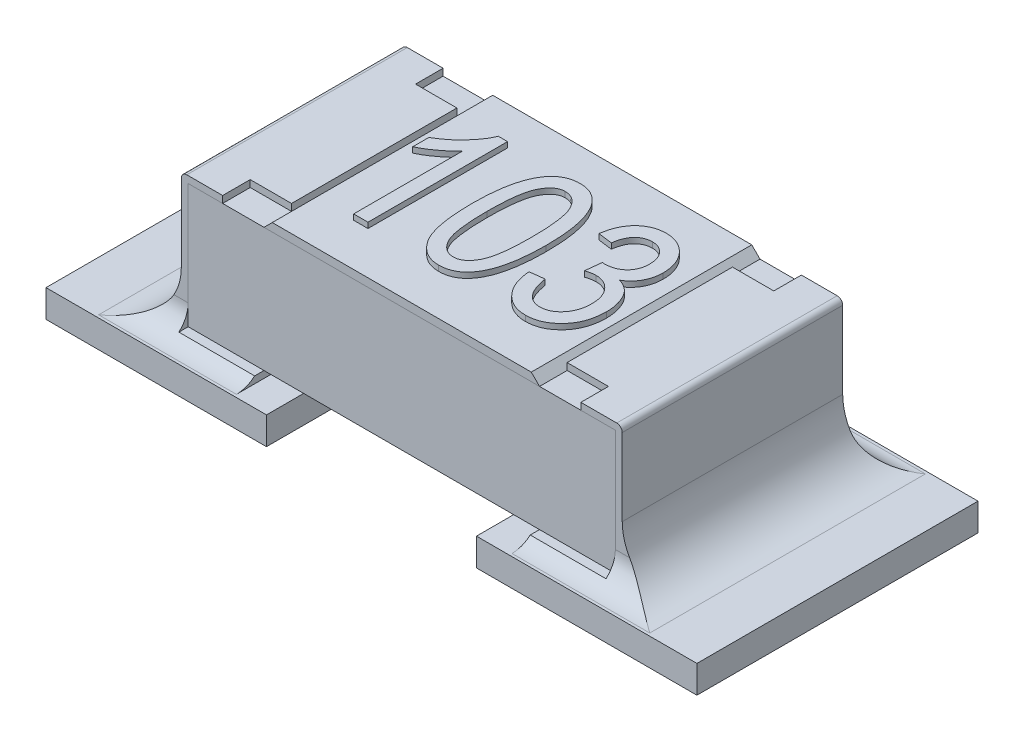
from build123d import *

# Parameters (mm, degrees)
SKETCH1_W             = 0.8
SKETCH1_H             = 0.45
BOSS_EXTRUDE1_DEPTH   = 0.775
BOSS_EXTRUDE2_DEPTH   = 0.4
BOSS_EXTRUDE2_2_DEPTH = 0.4
SKETCH3_W             = 0.15
SKETCH3_H             = 0.1
CUT_EXTRUDE1_DEPTH    = 0.025
BOSS_EXTRUDE3_DEPTH   = 0.4
SKETCH7_W             = 0.8
SKETCH7_H             = 1.02
BOSS_EXTRUDE5_DEPTH   = 0.1
FILLET3_R             = 0.2
FILLET4_R             = 0.2
FILLET5_R             = 0.1
FILLET6_R             = 0.1
BOSS_EXTRU_1_DEPTH    = 0.02


with BuildPart() as part:
    # Sketch1 → Boss-Extrude1 (new, symmetric)
    with BuildSketch(Plane(origin=(0, 0, 0), x_dir=(0, 0, -1), z_dir=(1, 0, 0))):
        with Locations((0, 0.35)):
            Rectangle(SKETCH1_W, SKETCH1_H)
    extrude(amount=BOSS_EXTRUDE1_DEPTH, both=True)


with BuildPart() as body_2:
    # Sketch2 → Boss-Extrude2 (new, symmetric)
    with BuildSketch(Plane.XY):
        with BuildLine():
            Line((-0.5, 0.6), (-0.78, 0.6))
            ThreePointArc((-0.78, 0.6), (-0.794142136, 0.594142136), (-0.8, 0.58))
            Line((-0.8, 0.58), (-0.8, 0.1))
            Line((-0.8, 0.1), (-0.5, 0.1))
            Line((-0.5, 0.1), (-0.5, 0.125))
            Line((-0.5, 0.125), (-0.775, 0.125))
            Line((-0.775, 0.125), (-0.775, 0.575))
            Line((-0.775, 0.575), (-0.5, 0.575))
            Line((-0.5, 0.575), (-0.5, 0.6))
        make_face()
    extrude(amount=BOSS_EXTRUDE2_DEPTH, both=True)


with BuildPart() as body_3:
    # Sketch2 → Boss-Extrude2 2 (new, symmetric)
    with BuildSketch(Plane.XY):
        with BuildLine():
            Line((0.5, 0.575), (0.5, 0.6))
            Line((0.5, 0.6), (0.78, 0.6))
            ThreePointArc((0.78, 0.6), (0.794142136, 0.594142136), (0.8, 0.58))
            Line((0.8, 0.58), (0.8, 0.1))
            Line((0.8, 0.1), (0.5, 0.1))
            Line((0.5, 0.1), (0.5, 0.125))
            Line((0.5, 0.125), (0.775, 0.125))
            Line((0.775, 0.125), (0.775, 0.575))
            Line((0.775, 0.575), (0.5, 0.575))
        make_face()
    extrude(amount=BOSS_EXTRUDE2_2_DEPTH, both=True)


with BuildPart() as cut_extrude1_tool:
    # Sketch3 → Cut-Extrude1 (new body)
    with BuildSketch(Plane(origin=(0, 0.6, 0), x_dir=(1, 0, 0), z_dir=(0, 1, 0))):
        with Locations((-0.575, 0.35)):
            Rectangle(SKETCH3_W, SKETCH3_H)
        with Locations((-0.575, -0.35)):
            Rectangle(SKETCH3_W, SKETCH3_H)
        with Locations((0.575, -0.35)):
            Rectangle(SKETCH3_W, SKETCH3_H)
        with Locations((0.575, 0.35)):
            Rectangle(SKETCH3_W, SKETCH3_H)
    extrude(amount=-CUT_EXTRUDE1_DEPTH)


with BuildPart() as body_2_1:
    add(body_2.part)

    # Cut-Extrude1: cut by cut_extrude1_tool
    add(cut_extrude1_tool.part, mode=Mode.SUBTRACT)



with BuildPart() as body_3_1:
    add(body_3.part)

    # Cut-Extrude1: cut by cut_extrude1_tool
    add(cut_extrude1_tool.part, mode=Mode.SUBTRACT)


with BuildPart() as body_4:
    # Sketch4 → Boss-Extrude3 (new, symmetric)
    with BuildSketch(Plane.XY):
        Polygon((-0.5, 0.575), (0.5, 0.575), (0.47, 0.605), (-0.47, 0.605), align=None)
    extrude(amount=BOSS_EXTRUDE3_DEPTH, both=True)

    # Esquisse2 → Boss.-Extru.1 (add)
    # profile 1 of 3: a face of its own
    with BuildSketch(Plane(origin=(0, 0.605, 0), x_dir=(1, 0, 0), z_dir=(0, 1, 0))):
        with BuildLine():
            Line((-0.277419159, -0.245221888), (-0.329367211, -0.245221888))
            Line((-0.329367211, -0.245221888), (-0.329367211, 0.150882009))
            add(Edge.make_bspline(
                [(-0.329367211, 0.150882009), (-0.33255753, 0.147209677), (-0.339169464, 0.139598774), (-0.350647442, 0.128775009), (-0.363438381, 0.1176135), (-0.377599648, 0.106782892), (-0.392028853, 0.096408923), (-0.406280373, 0.087284837), (-0.41982007, 0.079346193), (-0.428903295, 0.075031174), (-0.433263315, 0.072959931)],
                knots=[0, 0, 0, 0, 0.892555828, 1.849821039, 2.893015883, 4.008277588, 5.121255548, 6.154629642, 7.114207698, 8, 8, 8, 8], degree=3))
            Line((-0.433263315, 0.072959931), (-0.433263315, 0.131401489))
            add(Edge.make_bspline(
                [(-0.433263315, 0.131401489), (-0.426256411, 0.13561851), (-0.412302603, 0.144016443), (-0.392751491, 0.158564375), (-0.374281809, 0.174266475), (-0.35744561, 0.191287267), (-0.342370643, 0.208833156), (-0.329431452, 0.226343975), (-0.318822135, 0.243633673), (-0.313617925, 0.255526991), (-0.311104224, 0.261271619)],
                knots=[0, 0, 0, 0, 1.082272232, 2.155277244, 3.222407096, 4.289527553, 5.32168536, 6.282742408, 7.170542132, 8, 8, 8, 8], degree=3))
            Line((-0.311104224, 0.261271619), (-0.277419159, 0.261271619))
            Line((-0.277419159, 0.261271619), (-0.277419159, -0.245221888))
        make_face()
    # profile 2 of 3: a face of its own
    with BuildSketch(Plane(origin=(0, 0.605, 0), x_dir=(1, 0, 0), z_dir=(0, 1, 0))):
        with BuildLine():
            add(Edge.make_bspline(
                [(-0.147549029, 0.00457519), (-0.147466537, 0.01479126), (-0.147306358, 0.034628409), (-0.145650941, 0.063399949), (-0.143039858, 0.090278959), (-0.139489137, 0.115229398), (-0.134683655, 0.138255011), (-0.12902472, 0.15939274), (-0.122074419, 0.178575365), (-0.114251427, 0.195885139), (-0.105280253, 0.21122541), (-0.095389914, 0.224648892), (-0.084287025, 0.235937722), (-0.072277736, 0.245324824), (-0.059123137, 0.252476152), (-0.04501046, 0.257615666), (-0.029887534, 0.260717058), (-0.019452187, 0.261084261), (-0.014127763, 0.261271619)],
                knots=[0, 0, 0, 0, 1.522295809, 2.955932353, 4.292935845, 5.545987552, 6.709403679, 7.796379217, 8.803980711, 9.746667296, 10.623167879, 11.447716403, 12.224665142, 12.975696349, 13.710987297, 14.4460191, 15.207112772, 16, 16, 16, 16], degree=3))
            add(Edge.make_bspline(
                [(-0.014127763, 0.261271619), (-0.00938285, 0.261119405), (-6.4928e-05, 0.260820492), (0.013532278, 0.258355488), (0.026321328, 0.254161939), (0.038311883, 0.248334155), (0.04946752, 0.240809961), (0.059897997, 0.231712272), (0.069489012, 0.22085766), (0.075042737, 0.212703293), (0.0778974, 0.208511879)],
                knots=[0, 0, 0, 0, 1.02435884, 2.0116063, 2.972586715, 3.92329494, 4.881606269, 5.870473939, 6.905405214, 8, 8, 8, 8], degree=3))
            add(Edge.make_bspline(
                [(0.0778974, 0.208511879), (0.081201753, 0.202860902), (0.088073505, 0.191109101), (0.09627871, 0.171419216), (0.103194942, 0.149427268), (0.109026426, 0.125063264), (0.113186158, 0.098276968), (0.116478331, 0.069172575), (0.118383679, 0.037676929), (0.118581978, 0.015873733), (0.118684737, 0.00457519)],
                knots=[0, 0, 0, 0, 0.745747152, 1.550859881, 2.42529298, 3.372802996, 4.404287875, 5.514077945, 6.711780846, 8, 8, 8, 8], degree=3))
            add(Edge.make_bspline(
                [(0.118684737, 0.00457519), (0.118603246, -0.005573368), (0.118445039, -0.025275587), (0.116773055, -0.053910105), (0.114196761, -0.080658499), (0.110597814, -0.10553284), (0.105836898, -0.128501924), (0.100102772, -0.149633905), (0.093369381, -0.168919426), (0.085438101, -0.186231046), (0.076598991, -0.201660817), (0.066540873, -0.214948272), (0.055705564, -0.226438872), (0.043540388, -0.23562265), (0.030475546, -0.242976397), (0.016267757, -0.248029288), (0.001094421, -0.251174149), (-0.009377101, -0.25153216), (-0.014736529, -0.251715394)],
                knots=[0, 0, 0, 0, 1.513874866, 2.939007974, 4.277477108, 5.521918538, 6.686610019, 7.774777114, 8.786532326, 9.730252297, 10.61206932, 11.433487149, 12.211385775, 12.960169701, 13.698700869, 14.439280195, 15.201208188, 16, 16, 16, 16], degree=3))
            add(Edge.make_bspline(
                [(-0.014736529, -0.251715394), (-0.019516724, -0.251535975), (-0.028915126, -0.251183218), (-0.042705055, -0.248501144), (-0.05575647, -0.243876751), (-0.068138313, -0.237523555), (-0.079867046, -0.229401051), (-0.090799365, -0.219338145), (-0.101199397, -0.207599728), (-0.110942062, -0.19396939), (-0.119746041, -0.178096762), (-0.127188231, -0.159604049), (-0.133528749, -0.138579583), (-0.138560256, -0.114938484), (-0.142795274, -0.08877738), (-0.145456819, -0.059965056), (-0.147220924, -0.028557109), (-0.147436804, -0.006757381), (-0.147549029, 0.00457519)],
                knots=[0, 0, 0, 0, 0.713782411, 1.403376538, 2.088831486, 2.775699897, 3.476400496, 4.213162367, 4.989742879, 5.815463779, 6.710980744, 7.6941898, 8.787315853, 9.987366569, 11.302150399, 12.743876293, 14.307306722, 16, 16, 16, 16], degree=3))
        make_face()
        with BuildLine():
            add(Edge.make_bspline(
                [(-0.095600977, 0.004778112), (-0.095510395, -0.004962844), (-0.095337358, -0.023570963), (-0.094386416, -0.050273881), (-0.092589043, -0.074440086), (-0.090092676, -0.096145725), (-0.086927693, -0.115301137), (-0.083021376, -0.132011786), (-0.078366616, -0.146209724), (-0.072890289, -0.158097103), (-0.066817423, -0.167965156), (-0.060330818, -0.176373903), (-0.053623871, -0.183666527), (-0.046292266, -0.189491854), (-0.038680682, -0.194202042), (-0.030494994, -0.19727545), (-0.022023943, -0.199493814), (-0.016171753, -0.199675523), (-0.013214613, -0.199767342)],
                knots=[0, 0, 0, 0, 1.930873368, 3.688541263, 5.295281011, 6.732986767, 8.018032389, 9.141589856, 10.131594649, 10.974379403, 11.729767228, 12.422984227, 13.077418253, 13.687793181, 14.274134012, 14.843047171, 15.415386244, 16, 16, 16, 16], degree=3))
            add(Edge.make_bspline(
                [(-0.013214613, -0.199767342), (-0.010427064, -0.19967107), (-0.004876608, -0.199479377), (0.003214206, -0.197283662), (0.011014124, -0.194062792), (0.018392056, -0.189401372), (0.025337409, -0.183405877), (0.031944313, -0.176126804), (0.038222607, -0.167556151), (0.044243115, -0.157540122), (0.049661257, -0.145592351), (0.054269802, -0.131326946), (0.058147641, -0.114621658), (0.061355308, -0.095476215), (0.063679163, -0.073856395), (0.065539644, -0.049836144), (0.066465897, -0.023333722), (0.066643834, -0.004861208), (0.066736685, 0.004778112)],
                knots=[0, 0, 0, 0, 0.556098029, 1.107279675, 1.665020537, 2.239289732, 2.843790749, 3.494855459, 4.20099618, 4.965402842, 5.827994078, 6.818278647, 7.958442113, 9.254955883, 10.697998423, 12.305588537, 14.072183745, 16, 16, 16, 16], degree=3))
            add(Edge.make_bspline(
                [(0.066736685, 0.004778112), (0.066644247, 0.014518953), (0.066467022, 0.033194439), (0.065536544, 0.059932684), (0.063706558, 0.084163121), (0.061254358, 0.105841815), (0.058028708, 0.125018143), (0.054199757, 0.141717126), (0.049468888, 0.155886496), (0.044070333, 0.167750164), (0.037873861, 0.177530431), (0.031547138, 0.186066808), (0.024613966, 0.193179002), (0.017326453, 0.199101273), (0.009578464, 0.203716122), (0.001336, 0.207013805), (-0.007336855, 0.208998194), (-0.013272092, 0.209214654), (-0.016258444, 0.209323567)],
                knots=[0, 0, 0, 0, 1.926173374, 3.692928135, 5.28908838, 6.72993665, 8.005261178, 9.132588719, 10.113846285, 10.954579593, 11.702439438, 12.399284011, 13.051919516, 13.660808713, 14.251466784, 14.827675714, 15.41013748, 16, 16, 16, 16], degree=3))
            add(Edge.make_bspline(
                [(-0.016258444, 0.209323567), (-0.019046448, 0.209229838), (-0.024564948, 0.209044314), (-0.032588492, 0.206839344), (-0.040285896, 0.203615308), (-0.047609781, 0.198933153), (-0.054467733, 0.192853165), (-0.061128216, 0.185619176), (-0.067268818, 0.176971227), (-0.073311403, 0.16704689), (-0.078634531, 0.155067165), (-0.083250225, 0.140826575), (-0.086962575, 0.124091318), (-0.090243034, 0.105003485), (-0.092537193, 0.083411294), (-0.094405868, 0.059392779), (-0.095329633, 0.03288983), (-0.095507935, 0.014417392), (-0.095600977, 0.004778112)],
                knots=[0, 0, 0, 0, 0.557102101, 1.102712893, 1.655222221, 2.224793741, 2.834805151, 3.487045402, 4.190458401, 4.956245252, 5.811421647, 6.809929224, 7.950602775, 9.242777249, 10.688425301, 12.298918027, 14.068702942, 16, 16, 16, 16], degree=3))
        make_face(mode=Mode.SUBTRACT)
    # profile 3 of 3: a face of its own
    with BuildSketch(Plane(origin=(0, 0.605, 0), x_dir=(1, 0, 0), z_dir=(0, 1, 0))):
        with BuildLine():
            Line((0.170632789, -0.108858251), (0.222580841, -0.102364745))
            add(Edge.make_bspline(
                [(0.222580841, -0.102364745), (0.223250829, -0.106295854), (0.22455639, -0.113956147), (0.227125155, -0.124979634), (0.22992872, -0.135294754), (0.233178113, -0.144804398), (0.236720047, -0.153601456), (0.240647813, -0.161629834), (0.245039201, -0.16888819), (0.249786118, -0.175380729), (0.254903227, -0.181138198), (0.260367249, -0.186122883), (0.266229358, -0.190331218), (0.272433673, -0.193833451), (0.279078376, -0.196431554), (0.286032909, -0.198414424), (0.293399457, -0.199517263), (0.298436442, -0.199682771), (0.301010224, -0.199767342)],
                knots=[0, 0, 0, 0, 1.392235382, 2.712957193, 3.95076201, 5.123471921, 6.220028287, 7.260520794, 8.240826993, 9.178593426, 10.065213643, 10.926376853, 11.755607984, 12.580369742, 13.407158359, 14.241002189, 15.101193065, 16, 16, 16, 16], degree=3))
            add(Edge.make_bspline(
                [(0.301010224, -0.199767342), (0.303825283, -0.19971378), (0.309358329, -0.199608502), (0.31746663, -0.198040126), (0.325344292, -0.195898939), (0.332855478, -0.192563959), (0.340132453, -0.188466115), (0.347184329, -0.183522145), (0.353733984, -0.177410194), (0.360112096, -0.170691575), (0.365994713, -0.163232894), (0.371066918, -0.155086373), (0.37533871, -0.146371416), (0.378923333, -0.137192254), (0.381488545, -0.127399682), (0.383601675, -0.117188858), (0.384661656, -0.106343944), (0.384831463, -0.098950673), (0.384918504, -0.095161011)],
                knots=[0, 0, 0, 0, 0.904038564, 1.776903143, 2.648138989, 3.525264603, 4.411852617, 5.332561374, 6.2875971, 7.288147468, 8.311042921, 9.337403868, 10.368883854, 11.429611823, 12.501164111, 13.621320171, 14.780729868, 16, 16, 16, 16], degree=3))
            add(Edge.make_bspline(
                [(0.384918504, -0.095161011), (0.384826496, -0.091607761), (0.38464736, -0.084689696), (0.383662086, -0.074570464), (0.381856827, -0.064983483), (0.379159504, -0.05595494), (0.375965369, -0.047345761), (0.371888314, -0.03933172), (0.367077143, -0.031866947), (0.361634073, -0.025004423), (0.355624643, -0.018819667), (0.349286961, -0.013314715), (0.342518268, -0.008739927), (0.335489128, -0.004887872), (0.328007852, -0.002118976), (0.320292455, 8.4992e-05), (0.312175727, 0.00130226), (0.306661968, 0.001454003), (0.303851133, 0.001531359)],
                knots=[0, 0, 0, 0, 1.208507307, 2.352925112, 3.453685551, 4.520081629, 5.553915499, 6.572344605, 7.570902253, 8.569592363, 9.545641393, 10.499968035, 11.418701314, 12.319183888, 13.218416966, 14.125267075, 15.044288268, 16, 16, 16, 16], degree=3))
            add(Edge.make_bspline(
                [(0.303851133, 0.001531359), (0.301309415, 0.001451368), (0.29589117, 0.001280848), (0.287359372, -0.00019382), (0.277917334, -0.00226645), (0.271437206, -0.004300299), (0.268035387, -0.005367991)],
                knots=[0, 0, 0, 0, 0.832645691, 1.774971563, 2.831945141, 4, 4, 4, 4], degree=3))
            Line((0.268035387, -0.005367991), (0.274528893, 0.053479411))
            Line((0.274528893, 0.053479411), (0.282341393, 0.052769184))
            add(Edge.make_bspline(
                [(0.282341393, 0.052769184), (0.28535621, 0.052803375), (0.291239136, 0.052870094), (0.299843028, 0.054103025), (0.308050467, 0.05573649), (0.315778416, 0.058215582), (0.32312081, 0.06126306), (0.329963257, 0.06512583), (0.336430586, 0.069629935), (0.342407158, 0.074775592), (0.347772384, 0.080592975), (0.352565173, 0.086838036), (0.356526822, 0.093608382), (0.359818786, 0.100771608), (0.362342963, 0.108431244), (0.364185082, 0.116547048), (0.365164214, 0.125154849), (0.365345166, 0.131027254), (0.365437984, 0.134039476)],
                knots=[0, 0, 0, 0, 1.104467345, 2.155189185, 3.181695374, 4.170183668, 5.126157628, 6.092295424, 7.04536858, 8.012620263, 8.977961638, 9.942904556, 10.893715412, 11.848320646, 12.828840281, 13.845861792, 14.895045293, 16, 16, 16, 16], degree=3))
            add(Edge.make_bspline(
                [(0.365437984, 0.134039476), (0.365205154, 0.139435179), (0.364757695, 0.149804754), (0.361322938, 0.164574052), (0.355337719, 0.177647183), (0.347098304, 0.188824396), (0.337183227, 0.19783145), (0.326106912, 0.204581268), (0.31382294, 0.208580551), (0.305266447, 0.209072848), (0.300908763, 0.209323567)],
                knots=[0, 0, 0, 0, 1.168747258, 2.246123166, 3.262822778, 4.26410748, 5.234436762, 6.148309006, 7.056963545, 8, 8, 8, 8], degree=3))
            add(Edge.make_bspline(
                [(0.300908763, 0.209323567), (0.296380736, 0.209113033), (0.287572153, 0.208703473), (0.274976449, 0.204796436), (0.263388251, 0.198811303), (0.254940928, 0.191612698), (0.248954777, 0.184797154), (0.244731099, 0.179053945), (0.240977992, 0.172667561), (0.237797207, 0.165580977), (0.234735875, 0.157989828), (0.232570863, 0.149635141), (0.230408374, 0.14077154), (0.229528437, 0.134590959), (0.229074348, 0.131401489)],
                knots=[0, 0, 0, 0, 1.389180941, 2.702438466, 4.019316734, 5.377896697, 6.085434137, 6.807430375, 7.567469407, 8.358691296, 9.195188439, 10.081130764, 11.009773198, 12, 12, 12, 12], degree=3))
            Line((0.229074348, 0.131401489), (0.177126296, 0.137894996))
            add(Edge.make_bspline(
                [(0.177126296, 0.137894996), (0.177976911, 0.142845406), (0.179636207, 0.152502178), (0.183102865, 0.166397742), (0.187228647, 0.179379068), (0.19222398, 0.191374675), (0.197895954, 0.202488701), (0.204313267, 0.212674243), (0.211392332, 0.221998173), (0.219379085, 0.230202962), (0.227867658, 0.237510554), (0.236862982, 0.243821526), (0.246204676, 0.249253588), (0.256046714, 0.25362975), (0.26629668, 0.257099842), (0.277005895, 0.259528187), (0.288119335, 0.260963741), (0.2956624, 0.261168011), (0.299488309, 0.261271619)],
                knots=[0, 0, 0, 0, 1.259750421, 2.457396855, 3.589696629, 4.673763457, 5.713494597, 6.716289503, 7.690389722, 8.644478697, 9.583164327, 10.496506905, 11.397350125, 12.289843847, 13.194037124, 14.107891875, 15.040306322, 16, 16, 16, 16], degree=3))
            add(Edge.make_bspline(
                [(0.299488309, 0.261271619), (0.303519572, 0.261152706), (0.311450467, 0.260918763), (0.323107222, 0.259123737), (0.334317841, 0.256325888), (0.34505248, 0.252246796), (0.355215722, 0.246873647), (0.365057909, 0.240572938), (0.374413091, 0.233023939), (0.383134647, 0.224349983), (0.391140255, 0.214858231), (0.39816203, 0.204659864), (0.404193104, 0.193927052), (0.408982194, 0.18250432), (0.412725527, 0.170506984), (0.415460926, 0.157915535), (0.417135916, 0.144704426), (0.417301397, 0.135701715), (0.417386036, 0.131097106)],
                knots=[0, 0, 0, 0, 0.987546189, 1.94284647, 2.883618689, 3.814886987, 4.749064414, 5.696240478, 6.674807358, 7.688712876, 8.706405422, 9.713376545, 10.718845743, 11.717906576, 12.742863162, 13.794678478, 14.872046121, 16, 16, 16, 16], degree=3))
            add(Edge.make_bspline(
                [(0.417386036, 0.131097106), (0.417229743, 0.12553723), (0.416924506, 0.114678872), (0.413982335, 0.09892791), (0.409313119, 0.084150815), (0.402800714, 0.070445878), (0.394685499, 0.057883508), (0.384938112, 0.046771364), (0.373813758, 0.036921642), (0.365355289, 0.031747145), (0.361075159, 0.029128762)],
                knots=[0, 0, 0, 0, 1.090109576, 2.128968013, 3.132278696, 4.123864162, 5.09769889, 6.057339906, 7.016980922, 8, 8, 8, 8], degree=3))
            add(Edge.make_bspline(
                [(0.361075159, 0.029128762), (0.365006738, 0.027919056), (0.372688543, 0.025555446), (0.383286172, 0.020232713), (0.392949403, 0.014051368), (0.401583676, 0.006637104), (0.409263011, -0.002012587), (0.416120159, -0.011957767), (0.422011693, -0.023293485), (0.427334395, -0.035737208), (0.431505635, -0.049280075), (0.434710368, -0.063651321), (0.436527653, -0.078846612), (0.436751877, -0.089237754), (0.436866556, -0.094552245)],
                knots=[0, 0, 0, 0, 0.945190562, 1.846782401, 2.71900073, 3.580139159, 4.456653473, 5.37426406, 6.352713278, 7.392141409, 8.485180558, 9.608884637, 10.777077804, 12, 12, 12, 12], degree=3))
            add(Edge.make_bspline(
                [(0.436866556, -0.094552245), (0.436767054, -0.100206655), (0.436572795, -0.111245814), (0.434541302, -0.12742587), (0.431466768, -0.142815205), (0.427080999, -0.157468828), (0.421413591, -0.171273371), (0.414414732, -0.18430778), (0.406232011, -0.196573403), (0.396810932, -0.207898211), (0.386509539, -0.218037877), (0.375714857, -0.227099023), (0.364345387, -0.234700597), (0.352497961, -0.240980511), (0.340119591, -0.245749208), (0.327276517, -0.249234387), (0.313894434, -0.251292842), (0.304805128, -0.251573269), (0.300198536, -0.251715394)],
                knots=[0, 0, 0, 0, 1.16797173, 2.280242353, 3.364490462, 4.408173669, 5.436152277, 6.443028727, 7.460738993, 8.478233232, 9.481512989, 10.444418881, 11.386528098, 12.302557467, 13.209825675, 14.12198051, 15.04819242, 16, 16, 16, 16], degree=3))
            add(Edge.make_bspline(
                [(0.300198536, -0.251715394), (0.295930334, -0.251602688), (0.28752289, -0.25138068), (0.275179279, -0.249495111), (0.26333493, -0.246468911), (0.25203439, -0.242152829), (0.241145661, -0.236755504), (0.230837503, -0.230035031), (0.220981605, -0.222118498), (0.211720551, -0.213060002), (0.20325776, -0.202919877), (0.195571124, -0.191987861), (0.188819544, -0.180206271), (0.183323755, -0.167459779), (0.17862063, -0.15400335), (0.174859258, -0.139729734), (0.172100885, -0.124598771), (0.171128953, -0.11417798), (0.170632789, -0.108858251)],
                knots=[0, 0, 0, 0, 0.959274814, 1.889566238, 2.800731978, 3.703256649, 4.604498869, 5.528396462, 6.464265966, 7.442996794, 8.436156864, 9.429840861, 10.444772988, 11.483305447, 12.546329121, 13.647537524, 14.799087218, 16, 16, 16, 16], degree=3))
        make_face()
    extrude(amount=BOSS_EXTRU_1_DEPTH)


with BuildPart() as body_2_2:
    add(body_2_1.part)

    add(body_3_1.part)  # Boss-Extrude5 merges body 3
    # Sketch7 → Boss-Extrude5 (add)
    with BuildSketch(Plane(origin=(0, 0, 0), x_dir=(1, 0, 0), z_dir=(0, 1, 0))):
        with Locations((-0.781, 0)):
            Rectangle(SKETCH7_W, SKETCH7_H)
        with Locations((0.781, 0)):
            Rectangle(SKETCH7_W, SKETCH7_H)
    extrude(amount=BOSS_EXTRUDE5_DEPTH)

    # Fillet3
    fillet3_edges = [body_2_2.edges().sort_by_distance(p)[0] for p in [
        (-0.8, 0.1, 0),
    ]]
    fillet(fillet3_edges, radius=FILLET3_R)

    # Fillet4
    fillet4_edges = [body_2_2.edges().sort_by_distance(p)[0] for p in [
        (0.8, 0.1, 0),
    ]]
    fillet(fillet4_edges, radius=FILLET4_R)

    # Fillet5
    fillet5_edges = [body_2_2.edges().sort_by_distance(p)[0] for p in [
        (0.75, 0.1, 0.4),
    ]]
    fillet(fillet5_edges, radius=FILLET5_R)
    fillet5_2_edges = [body_2_2.edges().sort_by_distance(p)[0] for p in [
        (0.75, 0.1, -0.4),
    ]]
    fillet(fillet5_2_edges, radius=FILLET5_R)

    # Fillet6
    fillet6_edges = [body_2_2.edges().sort_by_distance(p)[0] for p in [
        (-0.75, 0.1, -0.4),
    ]]
    fillet(fillet6_edges, radius=FILLET6_R)
    fillet6_2_edges = [body_2_2.edges().sort_by_distance(p)[0] for p in [
        (-0.75, 0.1, 0.4),
    ]]
    fillet(fillet6_2_edges, radius=FILLET6_R)


solid = Compound([part.part, body_4.part, body_2_2.part])
